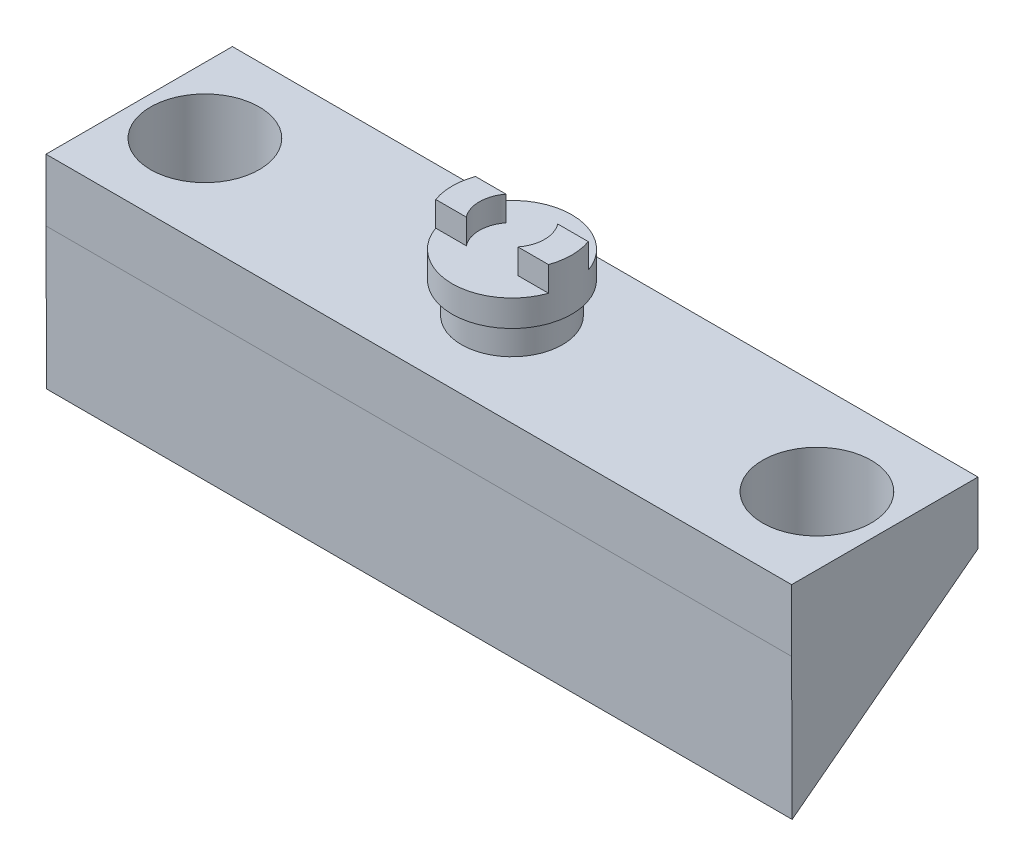
from build123d import *

# Parameters (mm, degrees)
SKETCH1_W           = 48
SKETCH1_H           = 12
SKETCH1_R           = 2
BOSS_EXTRUDE2_DEPTH = 4
SKETCH2_R           = 3.5
CUT_EXTRUDE5_DEPTH  = 45.577934645
SKETCH3_R           = 3.25
BOSS_EXTRUDE3_DEPTH = 2
SKETCH4_R           = 3.85
BOSS_EXTRUDE4_DEPTH = 3.3
SKETCH5_W           = 10.744623103
SKETCH5_H           = 3.104002229
SKETCH5_W_2         = 12.040799858
SKETCH5_H_2         = 4.707168217
CUT_EXTRUDE6_DEPTH  = 1.6
SKETCH6_R           = 2.1
CUT_EXTRUDE7_DEPTH  = 1.6
BOSS_EXTRUDE5_DEPTH = 48
SKETCH8_R           = 2
CUT_EXTRUDE8_DEPTH  = 46.361682699
SKETCH9_R           = 2
CUT_EXTRUDE9_DEPTH  = 46.361682699
SKETCH10_R          = 3.5
CUT_EXTRUDE10_DEPTH = 1


with BuildPart() as part:
    # Sketch1 → Boss-Extrude2 (new body)
    with BuildSketch(Plane(origin=(0, 0, 0), x_dir=(1, 0, 0), z_dir=(0, 1, 0))):
        with Locations((-18.755819717, 5.963784416)):
            Rectangle(SKETCH1_W, SKETCH1_H)
        with Locations((-38.525819717, 5.963784416)):
            Circle(SKETCH1_R, mode=Mode.SUBTRACT)
        with Locations((0.874180283, 5.963784416)):
            Circle(SKETCH1_R, mode=Mode.SUBTRACT)
    extrude(amount=BOSS_EXTRUDE2_DEPTH)

    # Sketch2 → Cut-Extrude5 (cut, through all)
    with BuildSketch(Plane(origin=(0, 4, 0), x_dir=(1, 0, 0), z_dir=(0, 1, 0))):
        with Locations((0.874180283, 5.963784416)):
            Circle(SKETCH2_R)
        with Locations((-38.525819717, 5.963784416)):
            Circle(SKETCH2_R)
    extrude(amount=-CUT_EXTRUDE5_DEPTH, mode=Mode.SUBTRACT)

    # Sketch3 → Boss-Extrude3 (add)
    with BuildSketch(Plane(origin=(0, 4, 0), x_dir=(1, 0, 0), z_dir=(0, 1, 0))):
        with Locations((-18.755819717, 5.963784416)):
            Circle(SKETCH3_R)
    extrude(amount=BOSS_EXTRUDE3_DEPTH)

    # Sketch4 → Boss-Extrude4 (add)
    with BuildSketch(Plane(origin=(0, 6, 0), x_dir=(1, 0, 0), z_dir=(0, 1, 0))):
        with Locations((-18.755819717, 5.963784416)):
            Circle(SKETCH4_R)
    extrude(amount=BOSS_EXTRUDE4_DEPTH)

    # Sketch5 → Cut-Extrude6 (cut)
    with BuildSketch(Plane(origin=(0, 9.3, 0), x_dir=(1, 0, 0), z_dir=(0, 1, 0))):
        with Locations((-18.784487645, 3.131783302)):
            Rectangle(SKETCH5_W, SKETCH5_H)
        with Locations((-18.682157901, 9.597368525)):
            Rectangle(SKETCH5_W_2, SKETCH5_H_2)
    extrude(amount=-CUT_EXTRUDE6_DEPTH, mode=Mode.SUBTRACT)

    # Sketch6 → Cut-Extrude7 (cut)
    with BuildSketch(Plane(origin=(0, 9.3, 0), x_dir=(1, 0, 0), z_dir=(0, 1, 0))):
        with Locations((-18.755819717, 5.963784416)):
            Circle(SKETCH6_R)
    extrude(amount=-CUT_EXTRUDE7_DEPTH, mode=Mode.SUBTRACT)

    # Sketch7 → Boss-Extrude5 (add)
    with BuildSketch(Plane(origin=(5.244180283, 0, 0), x_dir=(0, 0, -1), z_dir=(1, 0, 0))):
        Polygon((11.963784416, 0), (0, -9.109804798), (-0.036215584, 0), align=None)
    extrude(amount=-BOSS_EXTRUDE5_DEPTH)

    # Sketch8 → Cut-Extrude8 (cut, through all)
    with BuildSketch(Plane(origin=(0, 0, 0), x_dir=(1, 0, 0), z_dir=(0, 1, 0))):
        with Locations((0.874180283, 5.963784416)):
            Circle(SKETCH8_R)
    extrude(amount=-CUT_EXTRUDE8_DEPTH, mode=Mode.SUBTRACT)

    # Sketch9 → Cut-Extrude9 (cut, through all)
    with BuildSketch(Plane(origin=(0, 0, 0), x_dir=(1, 0, 0), z_dir=(0, 1, 0))):
        with Locations((-38.525819717, 5.963784416)):
            Circle(SKETCH9_R)
    extrude(amount=-CUT_EXTRUDE9_DEPTH, mode=Mode.SUBTRACT)

    # Sketch10 → Cut-Extrude10 (cut)
    with BuildSketch(Plane(origin=(0, 0, 0), x_dir=(1, 0, 0), z_dir=(0, 1, 0))):
        with Locations((0.874180283, 5.963784416)):
            Circle(SKETCH10_R)
        with Locations((-38.525819717, 5.963784416)):
            Circle(SKETCH10_R)
    extrude(amount=-CUT_EXTRUDE10_DEPTH, mode=Mode.SUBTRACT)


solid = part.part
